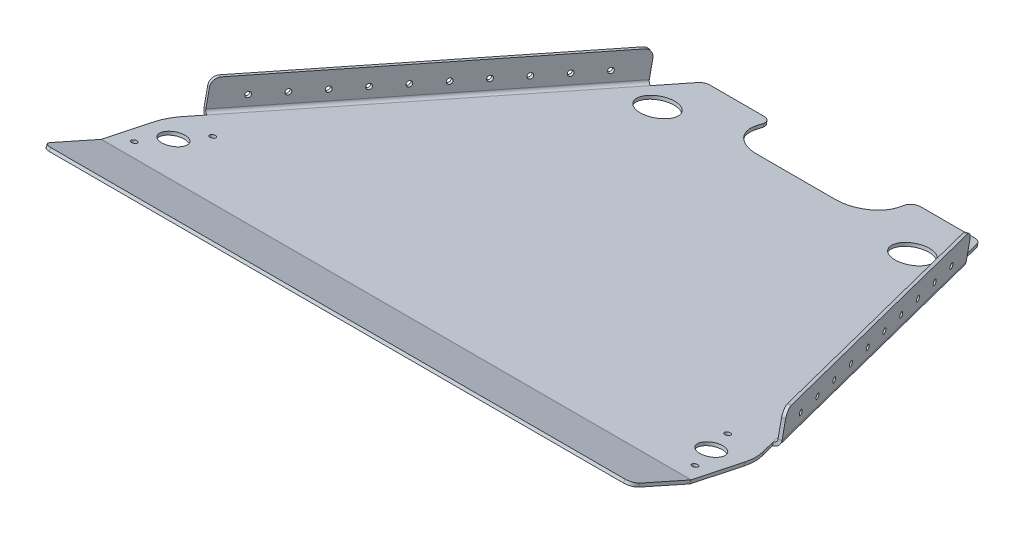
from build123d import *

# Parameters (mm, degrees)
BASE_FLANGE1_DEPTH               = 2.54
EDGE_FLANGE1_DEPTH               = 279.4
EDGE_FLANGE1_BEND_DEPTH          = 279.4
SKETCH12_R                       = 9.525
SKETCH12_R_2                     = 14.2875
CUT_EXTRUDE2_DEPTH               = 552.198202569
EDGE_FLANGE3_STRIP_CUT_DEPTH     = 476.25
EDGE_FLANGE3_DEPTH               = 476.25
F_1_4_0_25_DIAMETER_HOLE1_REACH  = 643.085
F_1_4_0_25_DIAMETER_HOLE1_BORE_R = 2.0955
F_8_CLEARANCE_HOLE1_D            = 4.4958
FILLET1_R                        = 50.8
FILLET2_R                        = 6.35


# Sheet-metal steps are written as plain solids
with BuildPart() as part:
    # Sketch19 → Base-Flange1 (new body)
    with BuildSketch(Plane(origin=(0, 0, 0), x_dir=(1, 0, 0), z_dir=(0, 0.9781476007338071, -0.20791169081775282))):
        with BuildLine():
            Line((238.125, -441.336030384), (111.125, -127))
            Line((111.125, -127), (57.15, -127))
            Line((57.15, -127), (57.15, -139.7))
            ThreePointArc((57.15, -139.7), (49.710512242, -157.660512242), (31.75, -165.1))
            Line((31.75, -165.1), (-31.75, -165.1))
            ThreePointArc((-31.75, -165.1), (-49.710512242, -157.660512242), (-57.15, -139.7))
            Line((-57.15, -139.7), (-57.15, -127))
            Line((-57.15, -127), (-111.125, -127))
            Line((-111.125, -127), (-238.125, -441.336030384))
            Line((-238.125, -441.336030384), (-238.125, -495.3))
            Line((-238.125, -495.3), (238.125, -495.3))
            Line((238.125, -495.3), (238.125, -441.336030384))
        make_face()
    extrude(amount=-BASE_FLANGE1_DEPTH)

    # Edge-Flange1 section (across the edge) → Edge-Flange1 (add)
    with BuildSketch(Plane(origin=(-126.299957317, 32.804075954, 154.331043448), x_dir=(0.9271838545667858, 0.07788509022858499, 0.36642054056884243), z_dir=(-0.3746065934159162, 0.19277236290190183, 0.9069226627836245))):
        with BuildLine():
            Line((-2.54, 2.54), (-2.54, 22.86))
            Line((-2.54, 22.86), (0, 22.86))
            Line((0, 22.86), (0, 2.54))
            ThreePointArc((0, 2.54), (0.743948776, 0.743948776), (2.54, 0))
            Line((2.54, 0), (2.54, -2.54))
            ThreePointArc((2.54, -2.54), (-1.052102448, -1.052102448), (-2.54, 2.54))
        make_face()
    extrude(amount=EDGE_FLANGE1_DEPTH)

    # Edge-Flange1 section 2 (across the edge) → Edge-Flange1 bend (add)
    with BuildSketch(Plane(origin=(230.965039518, 86.664674149, 407.72523543), x_dir=(-0.9271838545667858, 0.07788509022858499, 0.36642054056884243), z_dir=(-0.3746065934159162, -0.19277236290190183, -0.9069226627836245))):
        with BuildLine():
            Line((-2.54, 2.54), (-2.54, 22.86))
            Line((-2.54, 22.86), (0, 22.86))
            Line((0, 22.86), (0, 2.54))
            ThreePointArc((0, 2.54), (0.743948776, 0.743948776), (2.54, 0))
            Line((2.54, 0), (2.54, -2.54))
            ThreePointArc((2.54, -2.54), (-1.052102448, -1.052102448), (-2.54, 2.54))
        make_face()
    extrude(amount=EDGE_FLANGE1_BEND_DEPTH)

    # Sketch12 → Cut-Extrude2 (cut, symmetric)
    with BuildSketch(Plane(origin=(0, 0, 0), x_dir=(1, 0, 0), z_dir=(0, 0.9781476007338071, -0.20791169081775282))):
        with Locations(Location((-217.139677307, -457.2, 0), (0, 0, 270))):
            Circle(SKETCH12_R)
        with Locations(Location((-102.885908047, -174.411997752, 0), (0, 0, 270))):
            Circle(SKETCH12_R_2)
    cut_extrude2 = extrude(amount=CUT_EXTRUDE2_DEPTH, both=True, mode=Mode.SUBTRACT)

    # Mirror8: Cut-Extrude2 across plane
    add(cut_extrude2.mirror(Plane(origin=(0, 0, 0), x_dir=(0, 0, 1), z_dir=(1, 0, 0))), mode=Mode.SUBTRACT)

    # Edge-Flange3 strip (across the edge) → Edge-Flange3 strip cut (cut)
    with BuildSketch(Plane(origin=(-238.125, 102.978660462, 484.476506643), x_dir=(0, 0.9135454576426064, -0.40673664307578805), z_dir=(1, 0, 0))):
        Polygon((-5.59756398, 14.117742803), (-2.428989812, -0.789226632), (0.055505094, -0.261130937), (-3.113069074, 14.645838498), align=None)
    extrude(amount=EDGE_FLANGE3_STRIP_CUT_DEPTH, mode=Mode.SUBTRACT)

    # Edge-Flange3 section (across the edge) → Edge-Flange3 (add)
    with BuildSketch(Plane(origin=(-238.125, 102.978660462, 484.476506643), x_dir=(0, 0.9135454576426064, -0.40673664307578805), z_dir=(1, 0, 0))):
        with BuildLine():
            Line((-2.54, 0.266964758), (-2.54, 51.606851994))
            Line((-2.54, 51.606851994), (0, 51.606851994))
            Line((0, 51.606851994), (0, 0.266964758))
            ThreePointArc((0, 0.266964758), (0.013914386, 0.001462461), (0.055505094, -0.261130937))
            Line((0.055505094, -0.261130937), (-2.428989812, -0.789226632))
            ThreePointArc((-2.428989812, -0.789226632), (-2.512171228, -0.264039836), (-2.54, 0.266964758))
        make_face()
    extrude(amount=EDGE_FLANGE3_DEPTH)

    # 1/4 (0.25) Diameter Hole1 bore → 1/4 (0.25) Diameter Hole1 (cut, up to next)
    with BuildSketch(Plane(origin=(56.130105113, -4.715028502, -22.18246506), x_dir=(-0.36522461184560684, 0.02959733478276131, -0.9304488060479109), z_dir=(0.9271838545667707, -0.07788509022859282, -0.36642054056887907)), mode=Mode.PRIVATE) as f_1_4_0_25_diameter_hole1_sk1:
        with Locations((-211.258332787, 58.612157306)):
            Circle(F_1_4_0_25_DIAMETER_HOLE1_BORE_R)
    f_1_4_0_25_diameter_hole1_tool1 = extrude(f_1_4_0_25_diameter_hole1_sk1.sketch, amount=-F_1_4_0_25_DIAMETER_HOLE1_REACH, mode=Mode.PRIVATE) & part.part
    # 1/4 (0.25) Diameter Hole1 bore → 1/4 (0.25) Diameter Hole1 (cut, up to next)
    with BuildSketch(Plane(origin=(56.130105113, -4.715028502, -22.18246506), x_dir=(-0.36522461184560684, 0.02959733478276131, -0.9304488060479109), z_dir=(0.9271838545667707, -0.07788509022859282, -0.36642054056887907)), mode=Mode.PRIVATE) as f_1_4_0_25_diameter_hole1_sk2:
        with Locations((-236.022192538, 64.261161667)):
            Circle(F_1_4_0_25_DIAMETER_HOLE1_BORE_R)
    f_1_4_0_25_diameter_hole1_tool2 = extrude(f_1_4_0_25_diameter_hole1_sk2.sketch, amount=-F_1_4_0_25_DIAMETER_HOLE1_REACH, mode=Mode.PRIVATE) & part.part
    # 1/4 (0.25) Diameter Hole1 bore → 1/4 (0.25) Diameter Hole1 (cut, up to next)
    with BuildSketch(Plane(origin=(56.130105113, -4.715028502, -22.18246506), x_dir=(-0.36522461184560684, 0.02959733478276131, -0.9304488060479109), z_dir=(0.9271838545667707, -0.07788509022859282, -0.36642054056887907)), mode=Mode.PRIVATE) as f_1_4_0_25_diameter_hole1_sk3:
        with Locations((-260.786052288, 69.910166028)):
            Circle(F_1_4_0_25_DIAMETER_HOLE1_BORE_R)
    f_1_4_0_25_diameter_hole1_tool3 = extrude(f_1_4_0_25_diameter_hole1_sk3.sketch, amount=-F_1_4_0_25_DIAMETER_HOLE1_REACH, mode=Mode.PRIVATE) & part.part
    # 1/4 (0.25) Diameter Hole1 bore → 1/4 (0.25) Diameter Hole1 (cut, up to next)
    with BuildSketch(Plane(origin=(56.130105113, -4.715028502, -22.18246506), x_dir=(-0.36522461184560684, 0.02959733478276131, -0.9304488060479109), z_dir=(0.9271838545667707, -0.07788509022859282, -0.36642054056887907)), mode=Mode.PRIVATE) as f_1_4_0_25_diameter_hole1_sk4:
        with Locations((-285.549912038, 75.559170388)):
            Circle(F_1_4_0_25_DIAMETER_HOLE1_BORE_R)
    f_1_4_0_25_diameter_hole1_tool4 = extrude(f_1_4_0_25_diameter_hole1_sk4.sketch, amount=-F_1_4_0_25_DIAMETER_HOLE1_REACH, mode=Mode.PRIVATE) & part.part
    # 1/4 (0.25) Diameter Hole1 bore → 1/4 (0.25) Diameter Hole1 (cut, up to next)
    with BuildSketch(Plane(origin=(56.130105113, -4.715028502, -22.18246506), x_dir=(-0.36522461184560684, 0.02959733478276131, -0.9304488060479109), z_dir=(0.9271838545667707, -0.07788509022859282, -0.36642054056887907)), mode=Mode.PRIVATE) as f_1_4_0_25_diameter_hole1_sk5:
        with Locations((-310.313771788, 81.208174749)):
            Circle(F_1_4_0_25_DIAMETER_HOLE1_BORE_R)
    f_1_4_0_25_diameter_hole1_tool5 = extrude(f_1_4_0_25_diameter_hole1_sk5.sketch, amount=-F_1_4_0_25_DIAMETER_HOLE1_REACH, mode=Mode.PRIVATE) & part.part
    # 1/4 (0.25) Diameter Hole1 bore → 1/4 (0.25) Diameter Hole1 (cut, up to next)
    with BuildSketch(Plane(origin=(56.130105113, -4.715028502, -22.18246506), x_dir=(-0.36522461184560684, 0.02959733478276131, -0.9304488060479109), z_dir=(0.9271838545667707, -0.07788509022859282, -0.36642054056887907)), mode=Mode.PRIVATE) as f_1_4_0_25_diameter_hole1_sk6:
        with Locations((-335.077631539, 86.85717911)):
            Circle(F_1_4_0_25_DIAMETER_HOLE1_BORE_R)
    f_1_4_0_25_diameter_hole1_tool6 = extrude(f_1_4_0_25_diameter_hole1_sk6.sketch, amount=-F_1_4_0_25_DIAMETER_HOLE1_REACH, mode=Mode.PRIVATE) & part.part
    # 1/4 (0.25) Diameter Hole1 bore → 1/4 (0.25) Diameter Hole1 (cut, up to next)
    with BuildSketch(Plane(origin=(56.130105113, -4.715028502, -22.18246506), x_dir=(-0.36522461184560684, 0.02959733478276131, -0.9304488060479109), z_dir=(0.9271838545667707, -0.07788509022859282, -0.36642054056887907)), mode=Mode.PRIVATE) as f_1_4_0_25_diameter_hole1_sk7:
        with Locations((-359.841491289, 92.506183471)):
            Circle(F_1_4_0_25_DIAMETER_HOLE1_BORE_R)
    f_1_4_0_25_diameter_hole1_tool7 = extrude(f_1_4_0_25_diameter_hole1_sk7.sketch, amount=-F_1_4_0_25_DIAMETER_HOLE1_REACH, mode=Mode.PRIVATE) & part.part
    # 1/4 (0.25) Diameter Hole1 bore → 1/4 (0.25) Diameter Hole1 (cut, up to next)
    with BuildSketch(Plane(origin=(56.130105113, -4.715028502, -22.18246506), x_dir=(-0.36522461184560684, 0.02959733478276131, -0.9304488060479109), z_dir=(0.9271838545667707, -0.07788509022859282, -0.36642054056887907)), mode=Mode.PRIVATE) as f_1_4_0_25_diameter_hole1_sk8:
        with Locations((-384.605351039, 98.155187832)):
            Circle(F_1_4_0_25_DIAMETER_HOLE1_BORE_R)
    f_1_4_0_25_diameter_hole1_tool8 = extrude(f_1_4_0_25_diameter_hole1_sk8.sketch, amount=-F_1_4_0_25_DIAMETER_HOLE1_REACH, mode=Mode.PRIVATE) & part.part
    # 1/4 (0.25) Diameter Hole1 bore → 1/4 (0.25) Diameter Hole1 (cut, up to next)
    with BuildSketch(Plane(origin=(56.130105113, -4.715028502, -22.18246506), x_dir=(-0.36522461184560684, 0.02959733478276131, -0.9304488060479109), z_dir=(0.9271838545667707, -0.07788509022859282, -0.36642054056887907)), mode=Mode.PRIVATE) as f_1_4_0_25_diameter_hole1_sk9:
        with Locations((-409.369210789, 103.804192193)):
            Circle(F_1_4_0_25_DIAMETER_HOLE1_BORE_R)
    f_1_4_0_25_diameter_hole1_tool9 = extrude(f_1_4_0_25_diameter_hole1_sk9.sketch, amount=-F_1_4_0_25_DIAMETER_HOLE1_REACH, mode=Mode.PRIVATE) & part.part
    # 1/4 (0.25) Diameter Hole1 bore → 1/4 (0.25) Diameter Hole1 (cut, up to next)
    with BuildSketch(Plane(origin=(56.130105113, -4.715028502, -22.18246506), x_dir=(-0.36522461184560684, 0.02959733478276131, -0.9304488060479109), z_dir=(0.9271838545667707, -0.07788509022859282, -0.36642054056887907)), mode=Mode.PRIVATE) as f_1_4_0_25_diameter_hole1_sk10:
        with Locations((-434.13307054, 109.453196554)):
            Circle(F_1_4_0_25_DIAMETER_HOLE1_BORE_R)
    f_1_4_0_25_diameter_hole1_tool10 = extrude(f_1_4_0_25_diameter_hole1_sk10.sketch, amount=-F_1_4_0_25_DIAMETER_HOLE1_REACH, mode=Mode.PRIVATE) & part.part
    f_1_4_0_25_diameter_hole1_1 = f_1_4_0_25_diameter_hole1_tool1.solids().sort_by_distance((138.170012, 47.440645, 174.323788))[0]
    add(f_1_4_0_25_diameter_hole1_1, mode=Mode.SUBTRACT)
    f_1_4_0_25_diameter_hole1_2 = f_1_4_0_25_diameter_hole1_tool2.solids().sort_by_distance((147.685019, 52.337063, 197.359624))[0]
    add(f_1_4_0_25_diameter_hole1_2, mode=Mode.SUBTRACT)
    f_1_4_0_25_diameter_hole1_3 = f_1_4_0_25_diameter_hole1_tool3.solids().sort_by_distance((157.200027, 57.233482, 220.395459))[0]
    add(f_1_4_0_25_diameter_hole1_3, mode=Mode.SUBTRACT)
    f_1_4_0_25_diameter_hole1_4 = f_1_4_0_25_diameter_hole1_tool4.solids().sort_by_distance((166.715034, 62.1299, 243.431295))[0]
    add(f_1_4_0_25_diameter_hole1_4, mode=Mode.SUBTRACT)
    f_1_4_0_25_diameter_hole1_5 = f_1_4_0_25_diameter_hole1_tool5.solids().sort_by_distance((176.230042, 67.026318, 266.467131))[0]
    add(f_1_4_0_25_diameter_hole1_5, mode=Mode.SUBTRACT)
    f_1_4_0_25_diameter_hole1_6 = f_1_4_0_25_diameter_hole1_tool6.solids().sort_by_distance((185.745049, 71.922736, 289.502966))[0]
    add(f_1_4_0_25_diameter_hole1_6, mode=Mode.SUBTRACT)
    f_1_4_0_25_diameter_hole1_7 = f_1_4_0_25_diameter_hole1_tool7.solids().sort_by_distance((195.260057, 76.819154, 312.538802))[0]
    add(f_1_4_0_25_diameter_hole1_7, mode=Mode.SUBTRACT)
    f_1_4_0_25_diameter_hole1_8 = f_1_4_0_25_diameter_hole1_tool8.solids().sort_by_distance((204.775064, 81.715572, 335.574638))[0]
    add(f_1_4_0_25_diameter_hole1_8, mode=Mode.SUBTRACT)
    f_1_4_0_25_diameter_hole1_9 = f_1_4_0_25_diameter_hole1_tool9.solids().sort_by_distance((214.290072, 86.61199, 358.610473))[0]
    add(f_1_4_0_25_diameter_hole1_9, mode=Mode.SUBTRACT)
    f_1_4_0_25_diameter_hole1_10 = f_1_4_0_25_diameter_hole1_tool10.solids().sort_by_distance((223.805079, 91.508408, 381.646309))[0]
    add(f_1_4_0_25_diameter_hole1_10, mode=Mode.SUBTRACT)
    f_1_4_0_25_diameter_hole1 = f_1_4_0_25_diameter_hole1_1 + f_1_4_0_25_diameter_hole1_2 + f_1_4_0_25_diameter_hole1_3 + f_1_4_0_25_diameter_hole1_4 + f_1_4_0_25_diameter_hole1_5 + f_1_4_0_25_diameter_hole1_6 + f_1_4_0_25_diameter_hole1_7 + f_1_4_0_25_diameter_hole1_8 + f_1_4_0_25_diameter_hole1_9 + f_1_4_0_25_diameter_hole1_10  # 1/4 (0.25) Diameter Hole1 as one shape, for the pattern or mirror that repeats it

    # Mirror9: 1/4 (0.25) Diameter Hole1 across plane
    add(f_1_4_0_25_diameter_hole1.mirror(Plane(origin=(0, 0, 0), x_dir=(0, 0, 1), z_dir=(1, 0, 0))), mode=Mode.SUBTRACT)

    # #8 Clearance Hole1 (through all)
    with Locations(Plane(origin=(0, -2.484494906, 0.528095695), x_dir=(-1, 0, 0), z_dir=(0, -0.9781476007338071, 0.20791169081775288))):
        with Locations((-226.410703505, -480.146595062), (-207.868651108, -434.253404938), (207.868651108, -434.253404938), (226.410703505, -480.146595062)):
            Hole(F_8_CLEARANCE_HOLE1_D / 2)

    # Fillet1
    fillet1_edges = [part.edges().sort_by_distance(p)[0] for p in [
        (238.125, 90.516672843, 431.955827085),
        (-238.125, 90.516672843, 431.955827085),
    ]]
    fillet(fillet1_edges, radius=FILLET1_R)

    # Fillet2
    fillet2_edges = [part.edges().sort_by_distance(p)[0] for p in [
        (-238.125, 122.80885547, 532.138267402),
        (238.125, 122.80885547, 532.138267402),
        (111.125, 25.162537281, 124.488793141),
        (-111.125, 25.162537281, 124.488793141),
        (-57.15, 25.162537281, 124.488793141),
        (57.15, 25.162537281, 124.488793141),
        (-127.477480813, 55.065616042, 149.112828109),
        (-232.142563013, 108.926214237, 402.507020091),
        (232.142563013, 108.926214237, 402.507020091),
        (127.477480813, 55.065616042, 149.112828109),
    ]]
    fillet(fillet2_edges, radius=FILLET2_R)


solid = part.part
